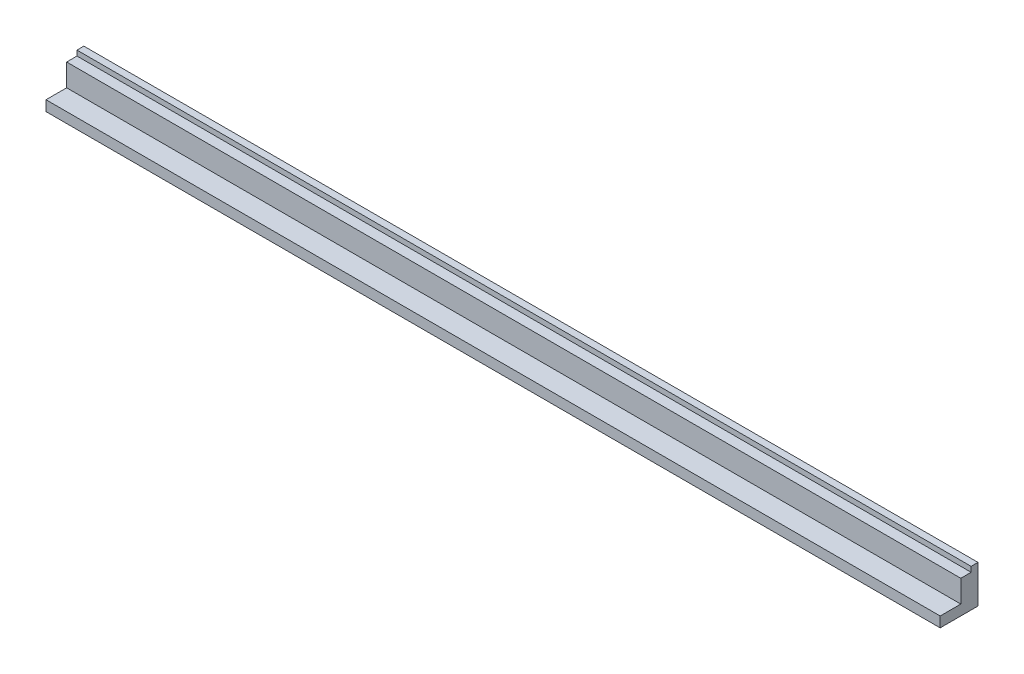
from build123d import *

# Parameters (mm, degrees)
EXTRUDE_1_DEPTH = 260


with BuildPart() as part:
    # Эскиз1 → Бобышка-Вытянуть1 (new body)
    with BuildSketch(Plane(origin=(0, 0, 0), x_dir=(0, 0, -1), z_dir=(1, 0, 0))):
        Polygon((0, 0), (-11, 0), (-11, 3), (-5, 3), (-5, 9.5), (-2, 9.5), (-2, 11), (0, 11), align=None)
    extrude(amount=EXTRUDE_1_DEPTH)


solid = part.part
